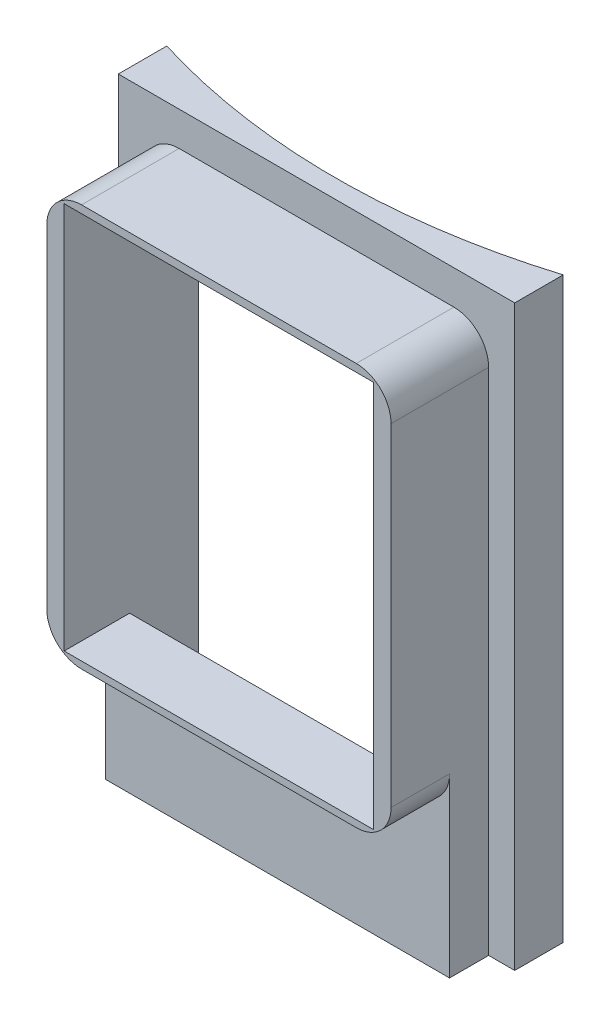
from build123d import *

# Parameters (mm, degrees)
SKETCH1_W           = 144.78
SKETCH1_H           = 211.158
EXTRUDE1_DEPTH      = 252.4252
SKETCH7_W           = 125.73
SKETCH7_H           = 198.713
EXTRUDE5_DEPTH      = 35.64418
EXTRUDE2_DEPTH      = 42.08
EXTRUDE2_DEPTH_BACK = 273.8502
SKETCH4_W           = 113.03
SKETCH4_H           = 141.48
SKETCH10_W          = 113.03
SKETCH10_H          = 51.882
EXTRUDE8_DEPTH      = 264.16
SKETCH2_R           = 245.618
EXTRUDE4_DEPTH      = 230
SKETCH12_W          = 125.73
SKETCH12_H          = 51.881
EXTRUDE10_DEPTH     = 21.36938
FILLET3_R           = 12.7


with BuildPart() as part:
    # Sketch1 → Extrude1 (new body)
    with BuildSketch(Plane.XY):
        with Locations((25.4, -19.219)):
            Rectangle(SKETCH1_W, SKETCH1_H)
    extrude(amount=EXTRUDE1_DEPTH)

    # Sketch7 → Extrude5 (add)
    with BuildSketch(Plane.XY.offset(252.4252)):
        with Locations((25.4, -25.4415)):
            Rectangle(SKETCH7_W, SKETCH7_H)
    extrude(amount=EXTRUDE5_DEPTH)

    # Sketch4 → Extrude2 (cut, two sides: drawn at the far end of the back side and taken through both)
    with BuildSketch(Plane.XY.offset(252.4252).offset(-EXTRUDE2_DEPTH_BACK)):
        with Locations((25.4, 0.364)):
            Rectangle(SKETCH4_W, SKETCH4_H)
    extrude(amount=EXTRUDE2_DEPTH + EXTRUDE2_DEPTH_BACK, mode=Mode.SUBTRACT)

    # Sketch10 → Extrude8 (cut)
    with BuildSketch(Plane(origin=(0, 0, 0), x_dir=(-1, 0, 0), z_dir=(0, 0, -1))):
        Polygon((-81.915, 71.104), (31.115, 71.104), align=None)
        with Locations((-25.4, -96.317)):
            Rectangle(SKETCH10_W, SKETCH10_H)
    extrude(amount=-EXTRUDE8_DEPTH, mode=Mode.SUBTRACT)

    # Sketch2 → Extrude4 (cut)
    with BuildSketch(Plane(origin=(0, 86.36, 0), x_dir=(-1, 0, 0), z_dir=(0, 1, 0))):
        with Locations((-25.4, 0)):
            Circle(SKETCH2_R)
    extrude(amount=-EXTRUDE4_DEPTH, mode=Mode.SUBTRACT)

    # Sketch12 → Extrude10 (cut)
    with BuildSketch(Plane.XY.offset(288.06938)):
        with Locations((25.4, -98.8575)):
            Rectangle(SKETCH12_W, SKETCH12_H)
    extrude(amount=-EXTRUDE10_DEPTH, mode=Mode.SUBTRACT)

    # Fillet3
    fillet3_edges = [part.edges().sort_by_distance(p)[0] for p in [
        (-37.465, -72.917, 277.38469),
        (88.265, -72.917, 277.38469),
        (88.265, 73.915, 270.24729),
        (-37.465, 73.915, 270.24729),
    ]]
    fillet(fillet3_edges, radius=FILLET3_R)


solid = part.part
